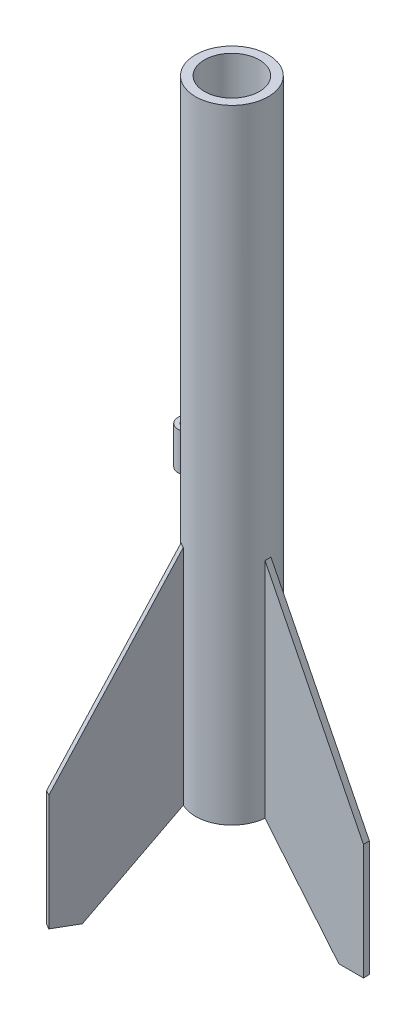
from build123d import *

# Parameters (mm, degrees)
SKETCH2_R                = 12.25
SKETCH2_R_2              = 9.25
BOSS_EXTRUDE1_DEPTH      = 210
SKETCH5_R                = 9.5
SKETCH5_R_2              = 4.625
BOSS_EXTRUDE2_DEPTH      = 12
BOSS_EXTRUDE3_DEPTH      = 1
CIRPATTERN1_COUNT        = 3
BOSS_EXTRUDE4_DEPTH      = 6.35
BOSS_EXTRUDE4_DEPTH_BACK = 6.35
SKETCH8_R                = 3.5
SKETCH8_R_2              = 2
SKETCH9_W                = 1
SKETCH9_H                = 16.330262046


with BuildPart() as part:
    # Sketch2 → Boss-Extrude1 (new body)
    with BuildSketch(Plane(origin=(-2.465768249, 0, -0.081027564), x_dir=(1, 0, 0), z_dir=(0, 1, 0))):
        with Locations((2.411661176, 0)):
            Circle(SKETCH2_R)
        with Locations((2.411661176, 0)):
            Circle(SKETCH2_R_2, mode=Mode.SUBTRACT)
    extrude(amount=BOSS_EXTRUDE1_DEPTH)

    # Sketch5 → Boss-Extrude2 (add)
    with BuildSketch(Plane(origin=(0, 60, 0), x_dir=(1, 0, 0), z_dir=(0, 1, 0))):
        with Locations((-0.054107074, 0.081027564)):
            Circle(SKETCH5_R)
        with Locations((-0.054107074, 0.081027564)):
            Circle(SKETCH5_R_2, mode=Mode.SUBTRACT)
    extrude(amount=BOSS_EXTRUDE2_DEPTH)

    # Sketch7 → Boss-Extrude3 (add, symmetric)
    with BuildSketch(Plane.XY):
        Polygon((12.195892926, 75.2), (9.828211369, 75.2), (11.195892926, 0), (12.195892926, 0), (37.059460314, -30), (45.34731611, -30), (45.34731611, 9), align=None)
    boss_extrude3 = extrude(amount=BOSS_EXTRUDE3_DEPTH, both=True)

    # CirPattern1: Boss-Extrude3 ×3 about axis
    cirpattern1_axis = Axis((-0.054107074, 210, -0.081027564), (0, -1, 0))
    for i in range(1, CIRPATTERN1_COUNT):
        add(boss_extrude3.rotate(cirpattern1_axis, i * 360 / CIRPATTERN1_COUNT))

    # Sketch8 → Boss-Extrude4 (add, two sides: drawn at the far end of the back side and taken through both)
    with BuildSketch(Plane(origin=(0.379836366, 95, 0), x_dir=(1, 0, 0), z_dir=(0, 1, 0)).offset(-BOSS_EXTRUDE4_DEPTH_BACK)):
        with Locations((-15, 0)):
            Circle(SKETCH8_R)
        with Locations((-15, 0)):
            Circle(SKETCH8_R_2, mode=Mode.SUBTRACT)
    extrude(amount=BOSS_EXTRUDE4_DEPTH + BOSS_EXTRUDE4_DEPTH_BACK)

    # Sketch9 → Revolve-Thin1 (revolve)
    with BuildSketch(Plane(origin=(0, 110, 0), x_dir=(1, 0, 0), z_dir=(0, 1, 0))):
        with Locations((-6.173250471, 0)):
            Rectangle(SKETCH9_W, SKETCH9_H)
    revolve(axis=Axis((-6.673250471, 110, -8.165131023), (0, 0, 1)))


solid = part.part
